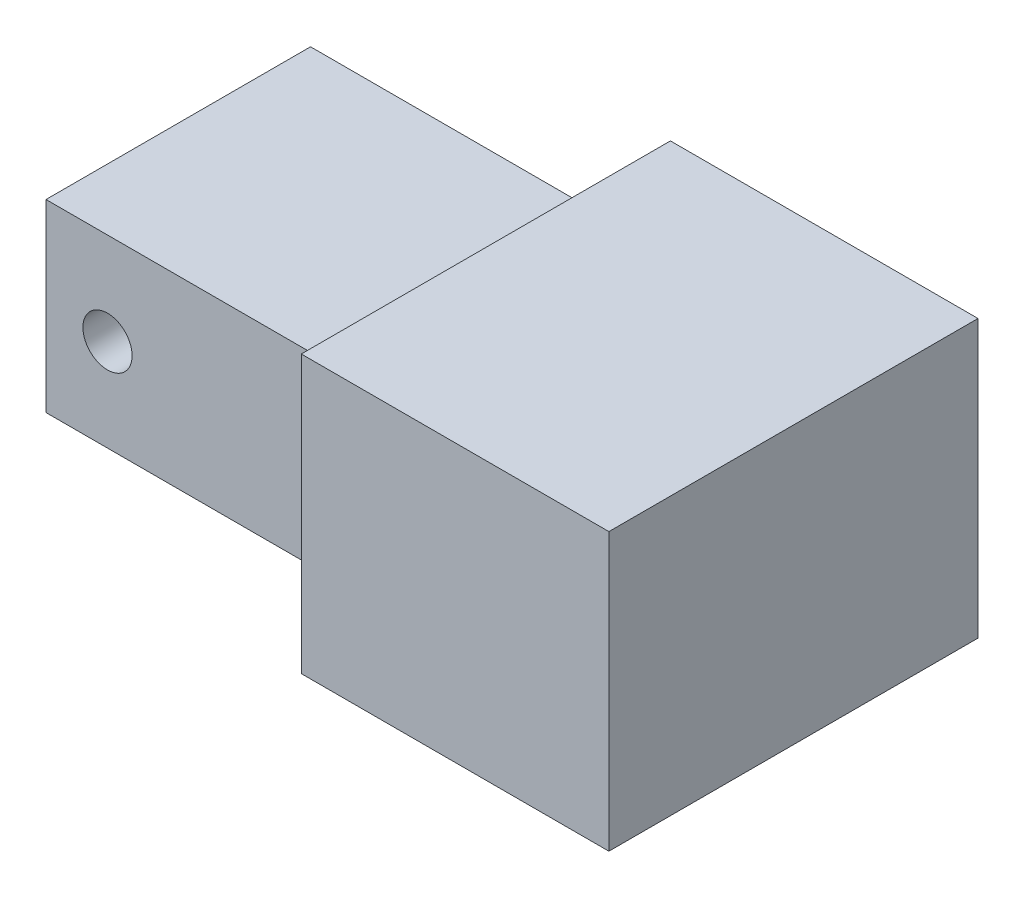
from build123d import *

# Parameters (mm, degrees)
SKETCH1_W           = 100
SKETCH1_H           = 30
SKETCH1_R           = 4
BOSS_EXTRUDE1_DEPTH = 21.5
SKETCH2_W           = 50
SKETCH2_H           = 60
BOSS_EXTRUDE2_DEPTH = 22.5


with BuildPart() as part:
    # Sketch1 → Boss-Extrude1 (new, symmetric)
    with BuildSketch(Plane.XY):
        Rectangle(SKETCH1_W, SKETCH1_H)
        with Locations((-40, 0)):
            Circle(SKETCH1_R, mode=Mode.SUBTRACT)
    extrude(amount=BOSS_EXTRUDE1_DEPTH, both=True)

    # Sketch2 → Boss-Extrude2 (add, symmetric)
    with BuildSketch(Plane(origin=(0, 0, 0), x_dir=(1, 0, 0), z_dir=(0, 1, 0))):
        with Locations((25, 0)):
            Rectangle(SKETCH2_W, SKETCH2_H)
    extrude(amount=BOSS_EXTRUDE2_DEPTH, both=True)


solid = part.part
